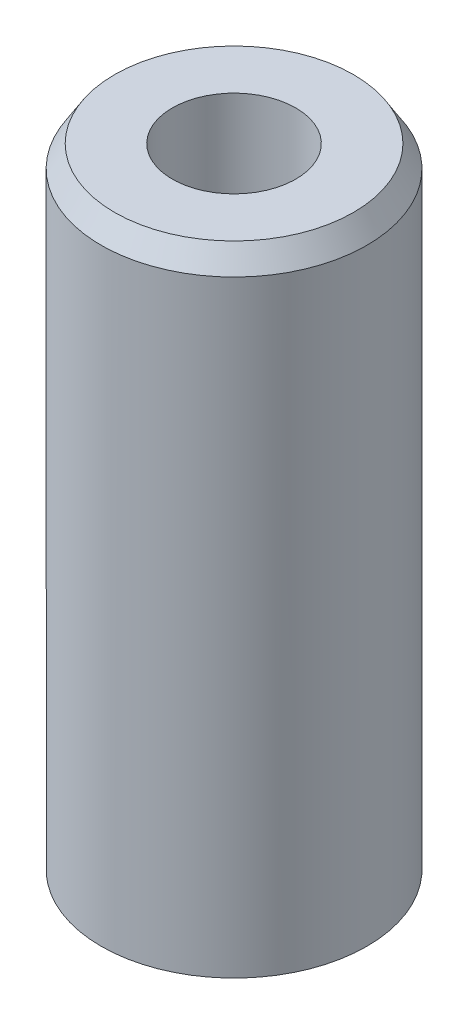
from build123d import *
from OCP.BRepFilletAPI import BRepFilletAPI_MakeChamfer

# Parameters (mm, degrees)
SKETCH1_R           = 20
BOSS_EXTRUDE1_DEPTH = 96.668004665
SKETCH2_R           = 9.292607885
CUT_EXTRUDE1_DEPTH  = 101.720917022
CHAMFER1_SIZE       = 3.266796008
CHAMFER1_SIZE2      = 2.025364513


with BuildPart() as part:
    # Sketch1 → Boss-Extrude1 (new body)
    with BuildSketch(Plane(origin=(0, 0, 0), x_dir=(1, 0, 0), z_dir=(0, 1, 0))):
        Circle(SKETCH1_R)
    extrude(amount=BOSS_EXTRUDE1_DEPTH)

    # Sketch2 → Cut-Extrude1 (cut, through all)
    with BuildSketch(Plane(origin=(0, 0, 0), x_dir=(1, 0, 0), z_dir=(0, 1, 0))):
        Circle(SKETCH2_R)
    extrude(amount=CUT_EXTRUDE1_DEPTH, mode=Mode.SUBTRACT)

    # Chamfer1: one chamfer whose edges measure the first distance from different faces: ONE call of the kernel's chamfer builder (chamfer() names one face for all edges)
    chamfer1_edges_1 = [part.edges().sort_by_distance(p)[0] for p in [
        (-20, 96.668004665, 0),
    ]]
    chamfer1_side_1 = [part.faces().sort_by_distance(p)[0] for p in [
        (-20, 48.334002332, 0),
    ]]
    chamfer1_edges_2 = [part.edges().sort_by_distance(p)[0] for p in [
        (-20, 0, 0),
    ]]
    chamfer1_side_2 = [part.faces().sort_by_distance(p)[0] for p in [
        (-19.434314575, 0, 0),
    ]]
    chamfer1 = BRepFilletAPI_MakeChamfer(part.part.solid().wrapped)
    for e in chamfer1_edges_1:
        chamfer1.Add(CHAMFER1_SIZE, CHAMFER1_SIZE2, e.wrapped, chamfer1_side_1[0].wrapped)  # the first distance lies on this face
    for e in chamfer1_edges_2:
        chamfer1.Add(CHAMFER1_SIZE, CHAMFER1_SIZE2, e.wrapped, chamfer1_side_2[0].wrapped)  # the first distance lies on this face
    add(Compound.cast(chamfer1.Shape()), mode=Mode.REPLACE)


solid = part.part
